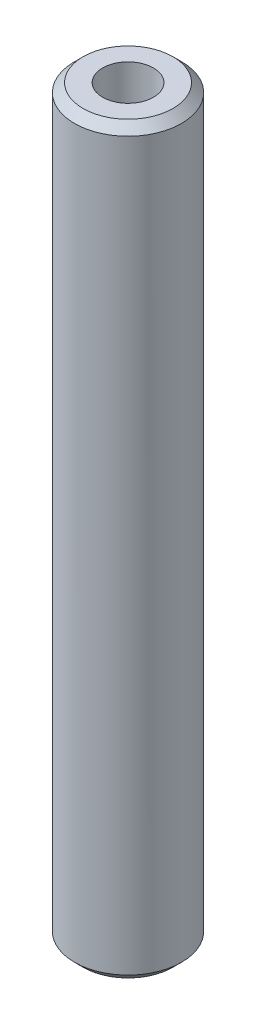
from build123d import *

# Parameters (mm, degrees)
SKETCH1_R           = 22.5
BOSS_EXTRUDE1_DEPTH = 312.60661041
SKETCH2_R           = 10.68168771
CUT_EXTRUDE1_DEPTH  = 315.221884776
CHAMFER1_SIZE       = 3.626155747


with BuildPart() as part:
    # Sketch1 → Boss-Extrude1 (new body)
    with BuildSketch(Plane(origin=(0, 0, 0), x_dir=(1, 0, 0), z_dir=(0, 1, 0))):
        Circle(SKETCH1_R)
    extrude(amount=BOSS_EXTRUDE1_DEPTH)

    # Sketch2 → Cut-Extrude1 (cut, through all)
    with BuildSketch(Plane(origin=(0, 0, 0), x_dir=(1, 0, 0), z_dir=(0, 1, 0))):
        Circle(SKETCH2_R)
    extrude(amount=CUT_EXTRUDE1_DEPTH, mode=Mode.SUBTRACT)

    # Chamfer1
    chamfer1_edges = [part.edges().sort_by_distance(p)[0] for p in [
        (-22.5, 312.60661041, 0),
        (-22.5, 0, 0),
    ]]
    chamfer(chamfer1_edges, length=CHAMFER1_SIZE)


solid = part.part
